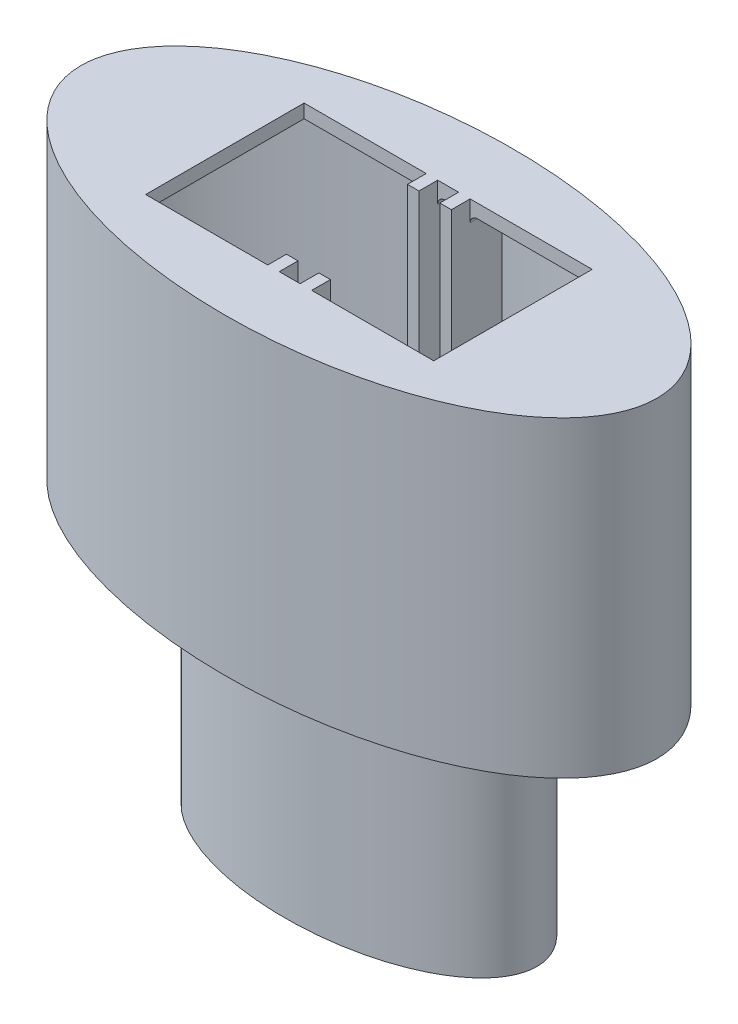
from build123d import *

# Parameters (mm, degrees)
SKETCH3_RX          = 50.8
SKETCH3_RY          = 25.4
BOSS_EXTRUDE1_DEPTH = 55.033333333
SKETCH4_RX          = 29.633333333
SKETCH4_RY          = 14.816666667
BOSS_EXTRUDE2_DEPTH = 42.333333249
CUT_EXTRUDE1_START  = -50.233333
SKETCH5_RX          = 48.4
SKETCH5_RY          = 23
CUT_EXTRUDE1_DEPTH  = 50.233333
CUT_EXTRUDE2_START  = -42.333333249
CUT_EXTRUDE2_DEPTH  = 42.333333249
CUT_EXTRUDE3_REACH  = 114.721
SKETCH7_W           = 50.8
SKETCH7_H           = 27.94
BOSS_EXTRUDE3_START = -2.4
SKETCH8_W           = 2.032
SKETCH8_H           = 8.89
BOSS_EXTRUDE3_DEPTH = 48.12
SKETCH11_W          = 2.032
SKETCH11_H          = 8.89
FILLET1_R           = 1.27


# Read off the part's stored shape, not the designer's step: Cut-Extrude2
with BuildPart() as part:
    # Sketch3 → Boss-Extrude1 (new body)
    with BuildSketch(Plane(origin=(0, 0, 0), x_dir=(1, 0, 0), z_dir=(0, 1, 0))):
        with Locations(Location((0, 0), (0, 0, 180))):
            Ellipse(SKETCH3_RX, SKETCH3_RY)
    extrude(amount=-BOSS_EXTRUDE1_DEPTH)

    # Sketch4 → Boss-Extrude2 (add)
    with BuildSketch(Plane.XZ.offset(55.033333333)):
        with Locations(Location((0, 0), (0, 0, 180))):
            Ellipse(SKETCH4_RX, SKETCH4_RY)
    extrude(amount=BOSS_EXTRUDE2_DEPTH)

    # Sketch5 → Cut-Extrude1 (cut)
    with BuildSketch(Plane(origin=(0, -2.400000026, 0), x_dir=(1, 0, 0), z_dir=(0, 1, 0)).offset(CUT_EXTRUDE1_START)):
        with Locations(Location((0, 0), (0, 0, -180))):
            Ellipse(SKETCH5_RX, SKETCH5_RY)
    extrude(amount=CUT_EXTRUDE1_DEPTH, mode=Mode.SUBTRACT)

    # Cut-Extrude2 outline → Cut-Extrude2 (cut)
    with BuildSketch(Plane(origin=(0, -94.966666556, 0), x_dir=(-1, 0, 0), z_dir=(0, -1, 0)).offset(CUT_EXTRUDE2_START)):
        with BuildLine():
            add(Edge.make_bspline(
                [(27.233333333, 0), (27.233333333, 0.65743884), (26.985129844, 1.972316519), (25.705591313, 4.131337933), (23.369189189, 6.336380478), (18.910906022, 9.066471368), (11.165174658, 11.674958543), (0, 12.787520729), (-11.165174658, 11.674958543), (-18.910906022, 9.066471368), (-23.369189189, 6.336380478), (-25.705591313, 4.131337933), (-26.985129844, 1.972316519), (-27.357435078, 0), (-26.985129844, -1.972316519), (-25.705591313, -4.131337933), (-23.369189189, -6.336380478), (-18.910906022, -9.066471368), (-11.165174658, -11.674958543), (0, -12.787520729), (11.165174658, -11.674958543), (18.910906022, -9.066471368), (23.369189189, -6.336380478), (25.705591313, -4.131337933), (26.985129844, -1.972316519), (27.233333333, -0.65743884), (27.233333333, 0)],
                knots=[0, 0, 0, 0, 0.196349541, 0.392699082, 0.589048623, 0.785398163, 1.178097245, 1.570796327, 1.963495408, 2.35619449, 2.552544031, 2.748893572, 2.945243113, 3.141592654, 3.337942194, 3.534291735, 3.730641276, 3.926990817, 4.319689899, 4.71238898, 5.105088062, 5.497787144, 5.694136685, 5.890486225, 6.086835766, 6.283185307, 6.283185307, 6.283185307, 6.283185307], degree=3))
        make_face()
    extrude(amount=CUT_EXTRUDE2_DEPTH, mode=Mode.SUBTRACT)

    # Sketch7 → Cut-Extrude3 (cut, up to next)
    with BuildSketch(Plane(origin=(0, 0, 0), x_dir=(1, 0, 0), z_dir=(0, 1, 0)), mode=Mode.PRIVATE) as cut_extrude3_sk1:
        Rectangle(SKETCH7_W, SKETCH7_H)
    cut_extrude3_tool1 = extrude(cut_extrude3_sk1.sketch, amount=-CUT_EXTRUDE3_REACH, mode=Mode.PRIVATE) & part.part
    add(cut_extrude3_tool1.solids().sort_by_distance((0, 0, 0))[0], mode=Mode.SUBTRACT)

    # Sketch8 → Boss-Extrude3 (add)
    with BuildSketch(Plane.XZ.offset(2.400000026).offset(BOSS_EXTRUDE3_START)):
        with Locations((-2.8575, 15.113)):
            Rectangle(SKETCH8_W, SKETCH8_H)
        with Locations((2.8575, 15.113)):
            Rectangle(SKETCH8_W, SKETCH8_H)
        with Locations((2.8575, -15.113)):
            Rectangle(SKETCH8_W, SKETCH8_H)
        with Locations((-2.8575, -15.113)):
            Rectangle(SKETCH8_W, SKETCH8_H)
    extrude(amount=BOSS_EXTRUDE3_DEPTH)

    # Sweep2: sweep along a path in Sketch10
    with BuildLine(Plane(origin=(0, 0, 15.113), x_dir=(-1, 0, 0), z_dir=(0, 0, -1))) as sweep2_path:
        ThreePointArc((-2.8575, -48.120000026), (0, -50.977500026), (2.8575, -48.120000026))
    # Sketch11 → Sweep2 (sweep)
    with BuildSketch(Plane.XZ.offset(48.120000026)):
        with Locations((-2.8575, 15.113)):
            Rectangle(SKETCH11_W, SKETCH11_H)
    sweep2 = sweep(path=sweep2_path.line)

    # Mirror2: Sweep2 across plane
    add(sweep2.mirror(Plane.XY))

    # Fillet1
    fillet1_edges = [part.edges().sort_by_distance(p)[0] for p in [
        (-2.8575, -2.400000026, 19.558),
        (-3.8735, -2.400000026, 16.764),
        (-1.8415, -2.400000026, 16.764),
        (2.8575, -2.400000026, 19.558),
        (1.8415, -2.400000026, 16.764),
        (3.8735, -2.400000026, 16.764),
        (1.8415, -2.400000026, -16.764),
        (2.8575, -2.400000026, -19.558),
        (3.8735, -2.400000026, -16.764),
        (-2.8575, -2.400000026, -19.558),
        (-1.8415, -2.400000026, -16.764),
        (-3.8735, -2.400000026, -16.764),
    ]]
    fillet(fillet1_edges, radius=FILLET1_R)


solid = part.part
